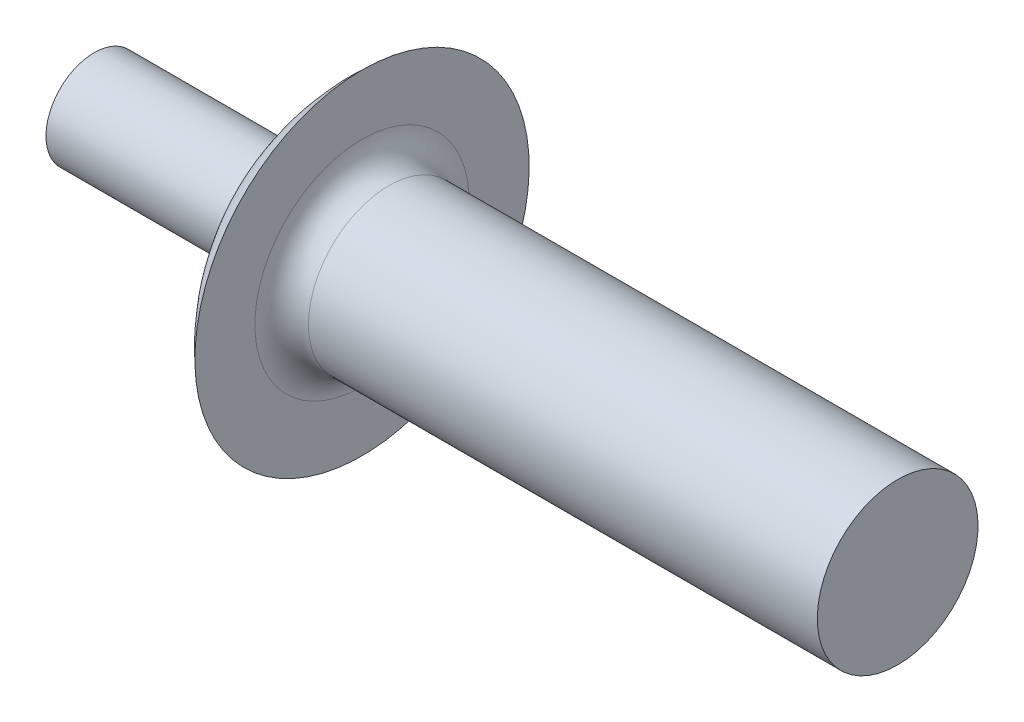
from build123d import *

# Parameters (mm, degrees)
FILLET1_R = 0.5


with BuildPart() as part:
    # Sketch1 → Base-Revolve (revolve)
    with BuildSketch(Plane(origin=(13.241356286, 10.121356286, 0), x_dir=(0, 1, 0), z_dir=(0, 0, 1))):
        with BuildLine():
            Line((-10.121356286, -1.758643714), (-8.621356286, -1.758643714))
            Line((-8.621356286, -1.758643714), (-8.621356286, 8.241356286))
            Line((-8.621356286, 8.241356286), (-7.001356286, 8.241356286))
            ThreePointArc((-7.001356286, 8.241356286), (-8.008580502, 9.067551486), (-9.221356286, 9.543234182))
            Line((-9.221356286, 9.543234182), (-9.221356286, 13.241356286))
            Line((-9.221356286, 13.241356286), (-10.121356286, 13.241356286))
            Line((-10.121356286, 13.241356286), (-10.121356286, -1.758643714))
        make_face()
    revolve(axis=Axis((-21.096328458, 0, 0), (1, 0, 0)))

    # Fillet1
    fillet1_edges = [part.edges().sort_by_distance(p)[0] for p in [
        (5, -1.5, 0),
    ]]
    fillet(fillet1_edges, radius=FILLET1_R)


solid = part.part
